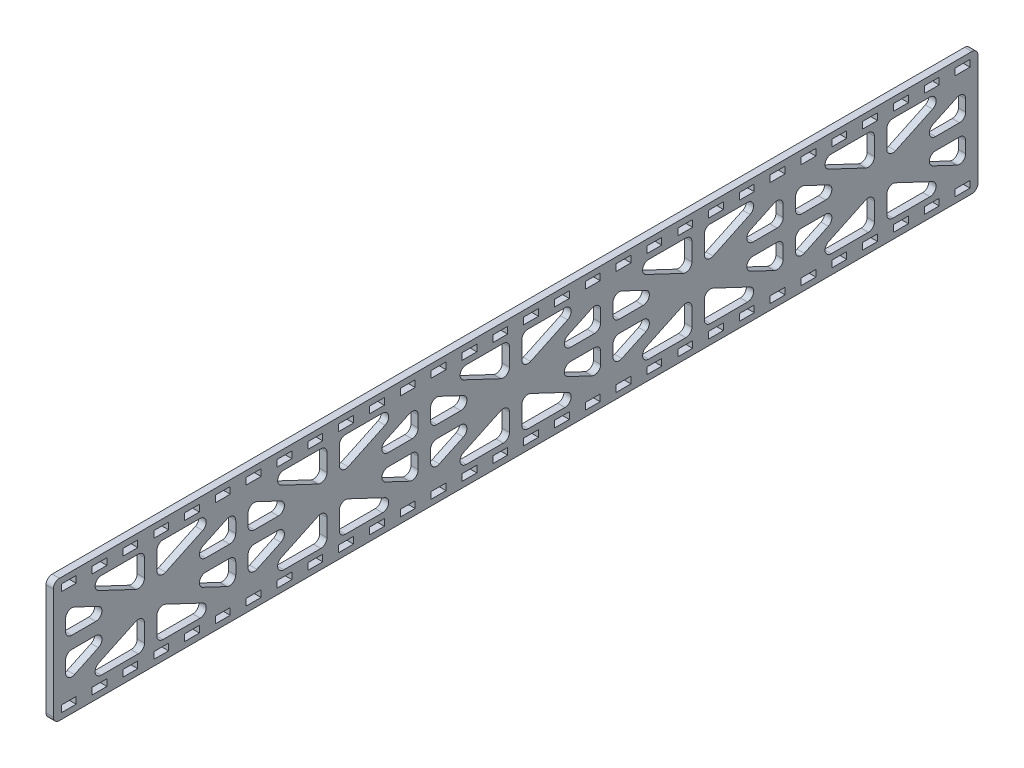
from build123d import *

# Parameters (mm, degrees)
SKETCH1_W          = 381
SKETCH1_H          = 50.8
OUTER_CUT_DEPTH    = 1.4986
CUT_EXTRUDE1_DEPTH = 193.209243294
FILLET1_R          = 2.54
SKETCH2_W          = 6.096
SKETCH2_H          = 2.746000096
SLOT_DEPTH         = 193.209243294
SLOTS_COUNT        = 16
SLOTS_PITCH        = 12.7
SLOTS_COUNT_DIR2   = 16
SLOTS_PITCH_DIR2   = 12.7


# Read off the part's stored shape, not the designer's step: Mirror1
with BuildPart() as part:
    # Sketch1 → Outer Cut (new, symmetric)
    with BuildSketch(Plane(origin=(0, 0, 0), x_dir=(0, 0, -1), z_dir=(1, 0, 0))):
        Rectangle(SKETCH1_W, SKETCH1_H)
    extrude(amount=OUTER_CUT_DEPTH, both=True)

    # Sketch3 → Cut-Extrude1 (cut, through all)
    with BuildSketch(Plane(origin=(1.4986, 0, 0), x_dir=(0, 0, -1), z_dir=(1, 0, 0))):
        Polygon((-185.42, -2.54), (-185.42, -13.768871955), (-161.678956438, -2.54), align=None)
        Polygon((-185.42, 13.768871955), (-185.42, 2.54), (-161.678956438, 2.54), align=None)
        Polygon((-152.908, 17.78), (-182.019329276, 17.78), (-152.908, 4.011128045), align=None)
        Polygon((-152.908, -4.011128045), (-182.019329276, -17.78), (-152.908, -17.78), align=None)
        Polygon((-147.828, -4.011128045), (-147.828, -17.78), (-118.716670724, -17.78), align=None)
        Polygon((-118.716670724, 17.78), (-147.828, 17.78), (-147.828, 4.011128045), align=None)
        Polygon((-115.316, 13.768871955), (-139.057043562, 2.54), (-115.316, 2.54), align=None)
        Polygon((-139.057043562, -2.54), (-115.316, -13.768871955), (-115.316, -2.54), align=None)
        Polygon((-110.236, -2.54), (-110.236, -13.768871955), (-86.494956438, -2.54), align=None)
        Polygon((-86.494956438, 2.54), (-110.236, 13.768871955), (-110.236, 2.54), align=None)
        Polygon((-77.724, -4.011128045), (-106.835329276, -17.78), (-77.724, -17.78), align=None)
        Polygon((-77.724, 17.78), (-106.835329276, 17.78), (-77.724, 4.011128045), align=None)
        Polygon((-43.532670724, 17.78), (-72.644, 17.78), (-72.644, 4.011128045), align=None)
        Polygon((-63.873043562, 2.54), (-40.132, 2.54), (-40.132, 13.768871955), align=None)
        Polygon((-63.873043562, -2.54), (-40.132, -13.768871955), (-40.132, -2.54), align=None)
        Polygon((-72.644, -17.78), (-43.532670724, -17.78), (-72.644, -4.011128045), align=None)
        Polygon((-35.052, -2.54), (-35.052, -13.768871955), (-11.310956438, -2.54), align=None)
        Polygon((-35.052, 2.54), (-11.310956438, 2.54), (-35.052, 13.768871955), align=None)
        Polygon((-2.54, 4.011128045), (-2.54, 17.78), (-31.651329276, 17.78), align=None)
        Polygon((-31.651329276, -17.78), (-2.54, -17.78), (-2.54, -4.011128045), align=None)
        Polygon((2.54, -17.78), (31.651329276, -17.78), (2.54, -4.011128045), align=None)
        Polygon((11.310956438, -2.54), (35.052, -13.768871955), (35.052, -2.54), align=None)
        Polygon((11.310956438, 2.54), (35.052, 2.54), (35.052, 13.768871955), align=None)
        Polygon((2.54, 4.011128045), (31.651329276, 17.78), (2.54, 17.78), align=None)
        Polygon((40.132, 2.54), (63.873043562, 2.54), (40.132, 13.768871955), align=None)
        Polygon((40.132, -2.54), (40.132, -13.768871955), (63.873043562, -2.54), align=None)
        Polygon((43.532670724, 17.78), (72.644, 4.011128045), (72.644, 17.78), align=None)
        Polygon((77.724, 17.78), (77.724, 4.011128045), (106.835329276, 17.78), align=None)
        Polygon((43.532670724, -17.78), (72.644, -17.78), (72.644, -4.011128045), align=None)
        Polygon((77.724, -17.78), (106.835329276, -17.78), (77.724, -4.011128045), align=None)
        Polygon((86.494956438, -2.54), (110.236, -13.768871955), (110.236, -2.54), align=None)
        Polygon((86.494956438, 2.54), (110.236, 2.54), (110.236, 13.768871955), align=None)
        Polygon((115.316, 13.768871955), (115.316, 2.54), (139.057043562, 2.54), align=None)
        Polygon((115.316, -2.54), (115.316, -13.768871955), (139.057043562, -2.54), align=None)
        Polygon((118.716670724, -17.78), (147.828, -17.78), (147.828, -4.011128045), align=None)
        Polygon((152.908, -4.011128045), (152.908, -17.78), (182.019329276, -17.78), align=None)
        Polygon((185.42, -2.54), (161.678956438, -2.54), (185.42, -13.768871955), align=None)
        Polygon((161.678956438, 2.54), (185.42, 2.54), (185.42, 13.768871955), align=None)
        Polygon((152.908, 17.78), (152.908, 4.011128045), (182.019329276, 17.78), align=None)
        Polygon((118.716670724, 17.78), (147.828, 4.011128045), (147.828, 17.78), align=None)
    extrude(amount=-CUT_EXTRUDE1_DEPTH, mode=Mode.SUBTRACT)

    # Fillet1
    fillet1_edges = [part.edges().sort_by_distance(p)[0] for p in [
        (0, -2.54, -35.052),
        (0, -13.768871955, -35.052),
        (0, -2.54, -11.310956438),
        (0, 13.768871955, -35.052),
        (0, 2.54, -35.052),
        (0, 2.54, -11.310956438),
        (0, 17.78, -31.651329276),
        (0, 4.011128045, -2.54),
        (0, 17.78, -2.54),
        (0, 13.768871955, -40.132),
        (0, 2.54, -63.873043562),
        (0, 2.54, -40.132),
        (0, -4.011128045, -2.54),
        (0, -17.78, -31.651329276),
        (0, -17.78, -2.54),
        (0, -4.011128045, 2.54),
        (0, -17.78, 2.54),
        (0, -17.78, 31.651329276),
        (0, 13.768871955, 35.052),
        (0, 2.54, 11.310956438),
        (0, 2.54, 35.052),
        (0, 17.78, 31.651329276),
        (0, 17.78, 2.54),
        (0, 4.011128045, 2.54),
        (0, 13.768871955, -115.316),
        (0, 2.54, -139.057043562),
        (0, 2.54, -115.316),
        (0, 13.768871955, -110.236),
        (0, 2.54, -110.236),
        (0, 2.54, -86.494956438),
        (0, -17.78, -106.835329276),
        (0, -17.78, -77.724),
        (0, -4.011128045, -77.724),
        (0, -2.54, -110.236),
        (0, -13.768871955, -110.236),
        (0, -2.54, -86.494956438),
        (0, -2.54, -40.132),
        (0, -2.54, -63.873043562),
        (0, -13.768871955, -40.132),
        (0, 4.011128045, -72.644),
        (0, 17.78, -43.532670724),
        (0, 17.78, -72.644),
        (0, 4.011128045, -77.724),
        (0, 17.78, -77.724),
        (0, 17.78, -106.835329276),
        (0, -17.78, -43.532670724),
        (0, -4.011128045, -72.644),
        (0, -17.78, -72.644),
        (0, -2.54, 110.236),
        (0, -2.54, 86.494956438),
        (0, -13.768871955, 110.236),
        (0, -2.54, 115.316),
        (0, -13.768871955, 115.316),
        (0, -2.54, 139.057043562),
        (0, 17.78, 118.716670724),
        (0, 4.011128045, 147.828),
        (0, 17.78, 147.828),
        (0, 13.768871955, 115.316),
        (0, 2.54, 115.316),
        (0, 2.54, 139.057043562),
        (0, -4.011128045, 147.828),
        (0, -17.78, 118.716670724),
        (0, -17.78, 147.828),
        (0, -4.011128045, 152.908),
        (0, -17.78, 152.908),
        (0, -17.78, 182.019329276),
        (0, 13.768871955, 185.42),
        (0, 2.54, 161.678956438),
        (0, 2.54, 185.42),
        (0, 17.78, 182.019329276),
        (0, 17.78, 152.908),
        (0, 4.011128045, 152.908),
        (0, 13.768871955, 40.132),
        (0, 2.54, 40.132),
        (0, 2.54, 63.873043562),
        (0, -2.54, 40.132),
        (0, -13.768871955, 40.132),
        (0, -2.54, 63.873043562),
        (0, -17.78, 43.532670724),
        (0, -17.78, 72.644),
        (0, -4.011128045, 72.644),
        (0, -2.54, 35.052),
        (0, -2.54, 11.310956438),
        (0, -13.768871955, 35.052),
        (0, 13.768871955, 110.236),
        (0, 2.54, 86.494956438),
        (0, 2.54, 110.236),
        (0, -17.78, 106.835329276),
        (0, -4.011128045, 77.724),
        (0, -17.78, 77.724),
        (0, 4.011128045, 77.724),
        (0, 17.78, 106.835329276),
        (0, 17.78, 77.724),
        (0, 4.011128045, 72.644),
        (0, 17.78, 72.644),
        (0, 17.78, 43.532670724),
        (0, -4.011128045, -147.828),
        (0, -17.78, -147.828),
        (0, -17.78, -118.716670724),
        (0, -2.54, -115.316),
        (0, -2.54, -139.057043562),
        (0, -13.768871955, -115.316),
        (0, -13.768871955, -185.42),
        (0, -2.54, -161.678956438),
        (0, -2.54, -185.42),
        (0, -4.011128045, -152.908),
        (0, -17.78, -182.019329276),
        (0, -17.78, -152.908),
        (0, 17.78, -182.019329276),
        (0, 4.011128045, -152.908),
        (0, 17.78, -152.908),
        (0, 13.768871955, -185.42),
        (0, 2.54, -185.42),
        (0, 2.54, -161.678956438),
        (0, 17.78, -118.716670724),
        (0, 17.78, -147.828),
        (0, 4.011128045, -147.828),
        (0, -2.54, 161.678956438),
        (0, -13.768871955, 185.42),
        (0, -2.54, 185.42),
        (0, 25.4, 190.5),
        (0, 25.4, -190.5),
        (0, -25.4, -190.5),
        (0, -25.4, 190.5),
    ]]
    fillet(fillet1_edges, radius=FILLET1_R)

    # Sketch2 → Slot (cut, through all)
    with BuildSketch(Plane(origin=(1.4986, 0, 0), x_dir=(0, 0, -1), z_dir=(1, 0, 0))):
        with Locations((6.35, 21.59)):
            Rectangle(SKETCH2_W, SKETCH2_H)
    slot = extrude(amount=-SLOT_DEPTH, mode=Mode.SUBTRACT)

    # Slots: Slot 16 × 16
    with Locations(*[Vector(0, 0, 1) * (i * SLOTS_PITCH) + Vector(0, 0, -1) * (j * SLOTS_PITCH_DIR2) for i in range(SLOTS_COUNT) for j in range(SLOTS_COUNT_DIR2) if (i, j) != (0, 0)]):
        add(slot, mode=Mode.SUBTRACT)

    # Mirror1
    split(bisect_by=Plane.ZX, keep=Keep.TOP)

    # Mirror1 2: part across plane


with BuildPart() as part_1:
    add(part.part)
    add(part.part.mirror(Plane.ZX))


solid = part_1.part
